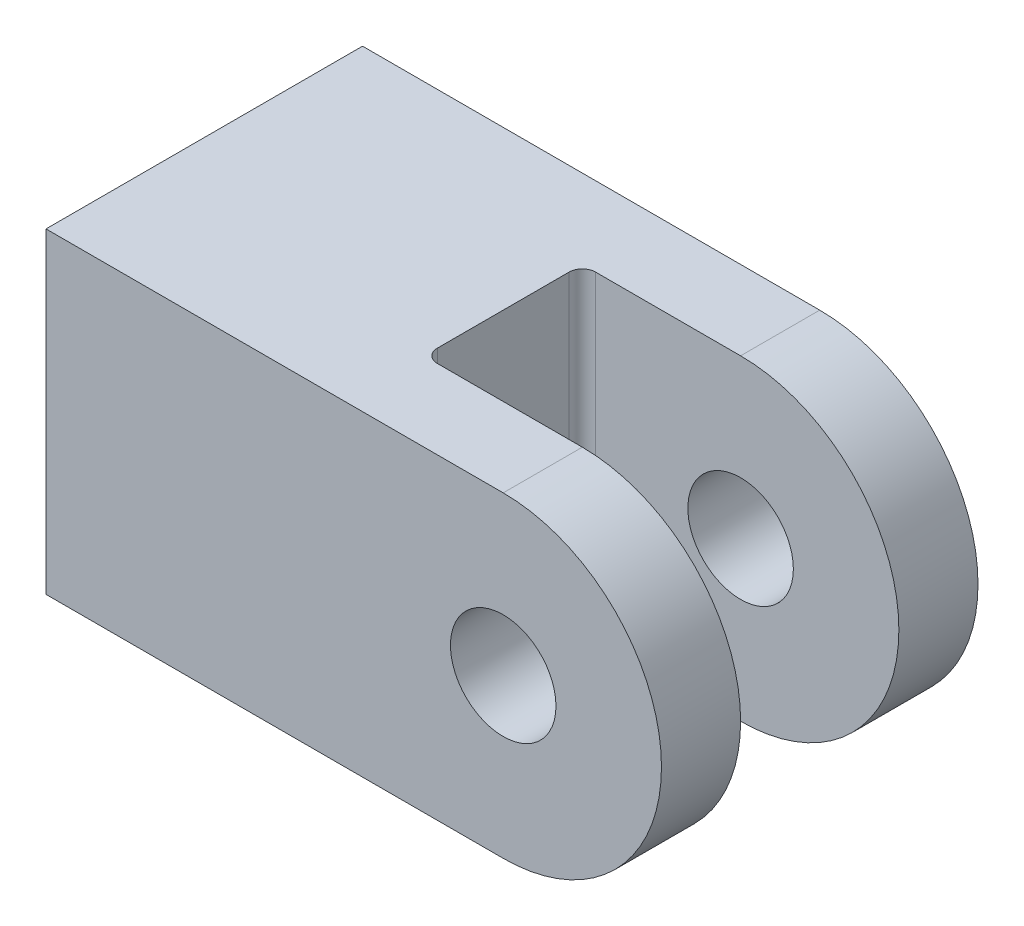
from build123d import *

# Parameters (mm, degrees)
CLEVIS_BODY_EXTRUDE1_DEPTH       = 18
SKETCH2_R                        = 6
PIN_HOLES_CUT_EXTRUDE1_DEPTH     = 18
SKETCH3_R                        = 7.5
THREADED_HOLE_CUT_EXTRUDE2_DEPTH = 25
SKETCH5_W                        = 38
SKETCH5_H                        = 18
CLEVIS_GAP_CUT_EXTRUDE4_DEPTH    = 81.746516953
FILLET2_R                        = 1.5
CHAMFER2_SIZE                    = 0.5


with BuildPart() as part:
    # Sketch1 → Clevis Body Extrude1 (new, symmetric)
    with BuildSketch(Plane.XY):
        with BuildLine():
            Line((0, 0), (52, 0))
            ThreePointArc((52, 0), (70, 18), (52, 36))
            Line((52, 36), (0, 36))
            Line((0, 36), (0, 0))
        make_face()
    extrude(amount=CLEVIS_BODY_EXTRUDE1_DEPTH, both=True)

    # Sketch2 → Pin Holes Cut-Extrude1 (cut, symmetric)
    with BuildSketch(Plane.XY):
        with Locations((52, 18)):
            Circle(SKETCH2_R)
    extrude(amount=PIN_HOLES_CUT_EXTRUDE1_DEPTH, both=True, mode=Mode.SUBTRACT)

    # Sketch3 → Threaded Hole Cut-Extrude2 (cut)
    with BuildSketch(Plane.ZY):
        with Locations((0, 18)):
            Circle(SKETCH3_R)
    extrude(amount=-THREADED_HOLE_CUT_EXTRUDE2_DEPTH, mode=Mode.SUBTRACT)

    # Sketch5 → Clevis Gap Cut-Extrude4 (cut, through all)
    with BuildSketch(Plane(origin=(0, 0, 0), x_dir=(1, 0, 0), z_dir=(0, 1, 0))):
        with Locations((53, 0)):
            Rectangle(SKETCH5_W, SKETCH5_H)
    extrude(amount=CLEVIS_GAP_CUT_EXTRUDE4_DEPTH, mode=Mode.SUBTRACT)

    # Fillet2
    fillet2_edges = [part.edges().sort_by_distance(p)[0] for p in [
        (34, 18, -9),
        (34, 18, 9),
    ]]
    fillet(fillet2_edges, radius=FILLET2_R)

    # Chamfer2
    chamfer2_edges = [part.edges().sort_by_distance(p)[0] for p in [
        (0, 18, -7.5),
    ]]
    chamfer(chamfer2_edges, length=CHAMFER2_SIZE)


solid = part.part
